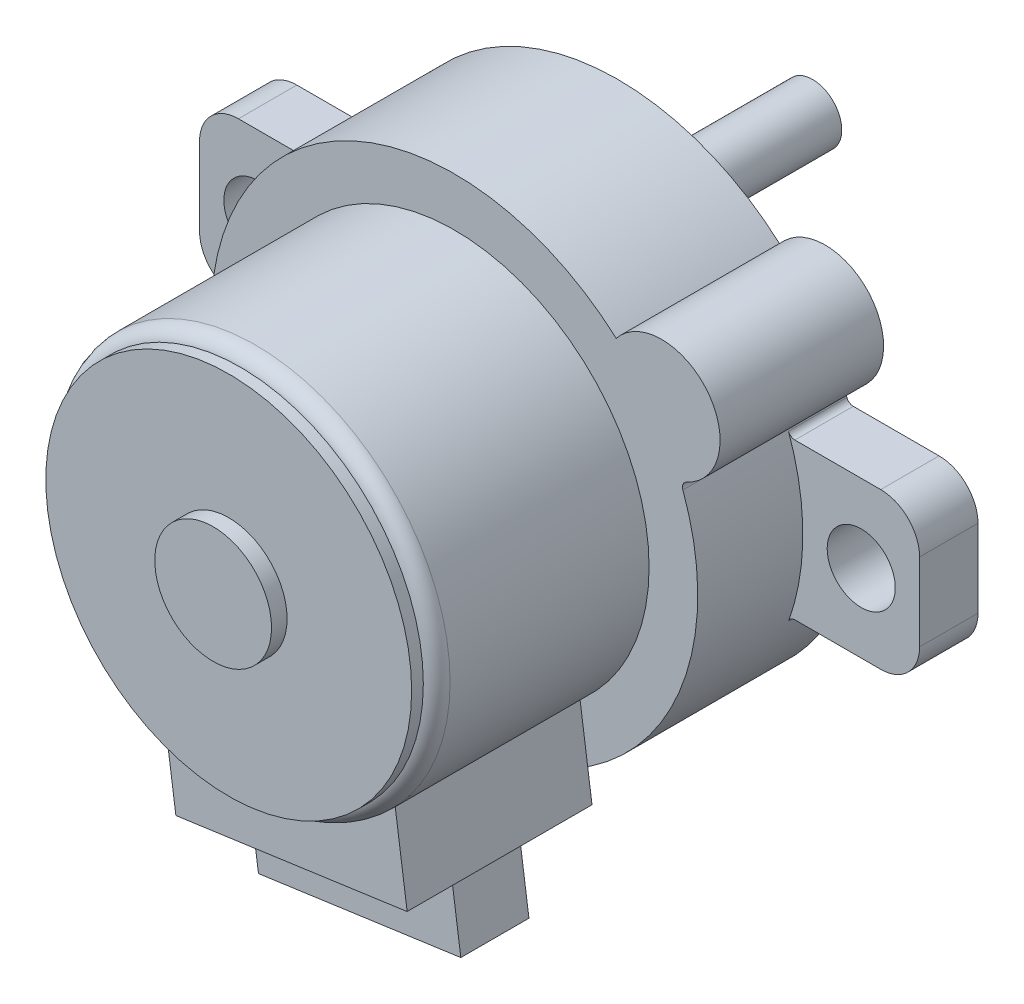
from build123d import *

# Parameters (mm, degrees)
SKETCH_1_R          = 10
EXTRUDE_1_DEPTH     = 11.6
SKETCH_2_R          = 12.5
EXTRUDE_2_DEPTH     = 8.4
EXTRUDE_START       = -3
SKETCH_3_R          = 1.75
SKETCH_3_R_2        = 1.749999999999227
EXTRUDE_3_DEPTH     = 3
EXTRUDE_START_2     = 5.4
EXTRUDE_4_DEPTH     = 5.4
SKETCH_5_R          = 3.000000000000001
EXTRUDE_5_DEPTH     = 2
SKETCH_6_R          = 1.5000000000000002
EXTRUDE_6_DEPTH     = 8
SKETCH_7_R          = 3
EXTRUDE_7_DEPTH     = 0.8
EXTRUDE_START_3     = -11
EXTRUDE_8_DEPTH     = 11
EXTRUDE_9_DEPTH     = 8
CUT_EXTRUDE_1_DEPTH = 4.5
FILLET_1_R          = 0.5
FILLET_4_R          = 0.35
CUT_EXTRUDE_START   = -1.5
CUT_EXTRUDE_2_DEPTH = 1.5
CUT_EXTRUDE_START_2 = -0.6
SKETCH_12_R         = 10
SKETCH_12_R_2       = 9.4
CUT_EXTRUDE_3_DEPTH = 0.6
FILLET_5_R          = 0.8


with BuildPart() as part:
    # ｽｹｯﾁ1 → ﾎﾞｽ - 押し出し1 (new body)
    with BuildSketch(Plane.XY):
        Circle(SKETCH_1_R)
    extrude(amount=EXTRUDE_1_DEPTH)

    # ｽｹｯﾁ2 → ﾎﾞｽ - 押し出し2 (add)
    with BuildSketch(Plane.XY):
        Circle(SKETCH_2_R)
    extrude(amount=-EXTRUDE_2_DEPTH)

    # ｽｹｯﾁ3 → ﾎﾞｽ - 押し出し3 (add)
    # profile 1 of 4: a face of its own
    with BuildSketch(Plane(origin=(0, 0, -8.4), x_dir=(-1, 0, 0), z_dir=(0, 0, -1)).offset(EXTRUDE_START)):
        with BuildLine():
            Line((-18.500000000000004, 2.0000000000000004), (-18.500000000000004, -2.0000000000000004))
            ThreePointArc((-18.500000000000004, -2.0000000000000004), (-17.914213562373096, -3.4142135623730976), (-16.5, -4))
            Line((-16.5, -4), (-11.842719282327012, -4.000000000000001))
            ThreePointArc((-11.842719282327012, -4.000000000000001), (-12.500000000000002, 1.53e-15), (-11.842719282327012, 4.000000000000001))
            Line((-11.842719282327012, 4.000000000000001), (-16.5, 4))
            ThreePointArc((-16.5, 4), (-17.914213562373096, 3.4142135623730976), (-18.500000000000004, 2.0000000000000004))
        make_face()
        with Locations((-15.5, 0)):
            Circle(SKETCH_3_R, mode=Mode.SUBTRACT)
    # profile 2 of 4: a face of its own
    with BuildSketch(Plane(origin=(0, 0, -8.4), x_dir=(-1, 0, 0), z_dir=(0, 0, -1)).offset(EXTRUDE_START)):
        with BuildLine():
            Line((16.50000000000071, 3.999999999997067), (11.842719282327723, 3.999999999997894))
            ThreePointArc((11.842719282327723, 3.999999999997894), (12.500000000000002, -2.22183e-12), (11.842719282326302, -4.000000000002104))
            Line((11.842719282326302, -4.000000000002104), (16.49999999999929, -4.000000000002934))
            ThreePointArc((16.49999999999929, -4.000000000002934), (17.914213562372492, -3.414213562376281), (18.49999999999965, -2.000000000003289))
            Line((18.49999999999965, -2.000000000003289), (18.500000000000355, 1.999999999996712))
            ThreePointArc((18.500000000000355, 1.999999999996712), (17.9142135623737, 3.414213562369911), (16.50000000000071, 3.999999999997067))
        make_face()
        with Locations((15.5, -2.75525e-12)):
            Circle(SKETCH_3_R_2, mode=Mode.SUBTRACT)
    # profile 3 of 4: a face of its own
    with BuildSketch(Plane(origin=(0, 0, -8.4), x_dir=(-1, 0, 0), z_dir=(0, 0, -1)).offset(EXTRUDE_START)):
        with BuildLine():
            ThreePointArc((-8.311246450809406, 9.336657990625344), (-10.239400553612443, 7.1697054543880165), (-11.616202318913265, 4.616691855222107))
            ThreePointArc((-11.616202318913265, 4.616691855222107), (-13.106432708623924, 9.177222981616662), (-8.311246450809406, 9.336657990625344))
        make_face()
    # profile 4 of 4: a face of its own
    with BuildSketch(Plane(origin=(0, 0, -8.4), x_dir=(-1, 0, 0), z_dir=(0, 0, -1)).offset(EXTRUDE_START)):
        with BuildLine():
            ThreePointArc((8.311246450807749, -9.33665799062682), (10.239400553611166, -7.169705454389839), (11.616202318912443, -4.6166918552241745))
            ThreePointArc((11.616202318912443, -4.6166918552241745), (13.106432708622291, -9.177222981618991), (8.311246450807749, -9.33665799062682))
        make_face()
    extrude(amount=EXTRUDE_3_DEPTH)

    # ｽｹｯﾁ4 → ﾎﾞｽ - 押し出し4 (add)
    with BuildSketch(Plane.XY.offset(-5.400000000000001).offset(EXTRUDE_START_2)):
        with BuildLine():
            ThreePointArc((-11.616202318912443, -4.616691855224174), (-13.10643270862229, -9.17722298161899), (-8.311246450807749, -9.336657990626819))
            ThreePointArc((-8.311246450807749, -9.336657990626819), (-10.239400553611167, -7.169705454389835), (-11.616202318912443, -4.616691855224174))
        make_face()
        with BuildLine():
            ThreePointArc((11.616202318913265, 4.616691855222107), (13.106432708623922, 9.177222981616662), (8.311246450809406, 9.336657990625344))
            ThreePointArc((8.311246450809406, 9.336657990625344), (10.23940055361244, 7.169705454388018), (11.616202318913265, 4.616691855222107))
        make_face()
    extrude(amount=-EXTRUDE_4_DEPTH)

    # ｽｹｯﾁ5 → ﾎﾞｽ - 押し出し5 (add)
    with BuildSketch(Plane(origin=(0, 0, -8.4), x_dir=(-1, 0, 0), z_dir=(0, 0, -1))):
        with Locations(Location((1.1e-16, 6, 0), (0, 0, 180))):
            Circle(SKETCH_5_R)
    extrude(amount=EXTRUDE_5_DEPTH)

    # ｽｹｯﾁ6 → ﾎﾞｽ - 押し出し6 (add)
    with BuildSketch(Plane(origin=(0, 0, -10.400000000000002), x_dir=(-1, 0, 0), z_dir=(0, 0, -1))):
        with Locations((1.1e-16, 6)):
            Circle(SKETCH_6_R)
    extrude(amount=EXTRUDE_6_DEPTH)

    # ｽｹｯﾁ7 → ﾎﾞｽ - 押し出し7 (add)
    with BuildSketch(Plane.XY.offset(11.6)):
        Circle(SKETCH_7_R)
    extrude(amount=EXTRUDE_7_DEPTH)

    # ｽｹｯﾁ8 → ﾎﾞｽ - 押し出し8 (add)
    with BuildSketch(Plane.XY.offset(11.6).offset(EXTRUDE_START_3)):
        with BuildLine():
            Line((-4.215861960544603, -13.114362658155867), (7.667354864354238, -11.444285446635076))
            Line((7.667354864354238, -11.444285446635076), (7.054993220129948, -7.087105944172167))
            ThreePointArc((7.054993220129948, -7.087105944172167), (1.3917310096006568, -9.902680687415703), (-4.828223604768894, -8.757183155692958))
            Line((-4.828223604768894, -8.757183155692958), (-4.215861960544603, -13.114362658155867))
        make_face()
    extrude(amount=EXTRUDE_8_DEPTH)

    # ｽｹｯﾁ9 → ﾎﾞｽ - 押し出し9 (add)
    with BuildSketch(Plane.XY.offset(11.6)):
        Polygon((-3.4731609089884254, -13.009982832435817), (-2.9721377455321845, -16.57494787990548), (7.4256769762543025, -15.113630319824779), (6.924653812798063, -11.548665272355127), align=None)
    extrude(amount=-EXTRUDE_9_DEPTH)

    # ｽｹｯﾁ10 → ｶｯﾄ - 押し出し1 (cut)
    with BuildSketch(Plane.XY.offset(11.6)):
        Polygon((6.924653812798063, -11.548665272355127), (-3.4731609089884254, -13.009982832435817), (-2.9721377455321845, -16.57494787990548), (7.4256769762543025, -15.113630319824779), align=None)
    extrude(amount=-CUT_EXTRUDE_1_DEPTH, mode=Mode.SUBTRACT)

    # ﾌｨﾚｯﾄ1
    fillet_1_edges = [part.edges().sort_by_distance(p)[0] for p in [
        (1.7257464519048185, -12.279324052395472, 3.5999999999999996),
        (-3.4731609089884254, -13.009982832435817, 5.35),
        (6.924653812798063, -11.548665272355127, 5.35),
        (1.7257464519048185, -12.279324052395472, 7.1),
    ]]
    fillet(fillet_1_edges, radius=FILLET_1_R)

    # ﾌｨﾚｯﾄ4
    fillet_4_edges = [part.edges().sort_by_distance(p)[0] for p in [
        (11.616202318913265, 4.616691855222108, -4.200000000000001),
        (11.84271928232701, 4.000000000000002, -6.9),
        (11.84271928232701, -4.000000000000001, -6.9),
        (-11.616202318912443, -4.6166918552241745, -4.2),
        (-11.8427192823263, -4.000000000002105, -6.9),
        (-11.842719282327721, 3.999999999997894, -6.9),
    ]]
    fillet(fillet_4_edges, radius=FILLET_4_R)

    # ｽｹｯﾁ11 → ｶｯﾄ - 押し出し2 (cut)
    with BuildSketch(Plane.XY.offset(11.6).offset(CUT_EXTRUDE_START)):
        with BuildLine():
            Line((-4.828223604768897, -8.757183155692957), (-4.215861960544603, -13.114362658155867))
            Line((-4.215861960544603, -13.114362658155867), (7.667354864354238, -11.444285446635076))
            Line((7.667354864354238, -11.444285446635076), (7.054993220129944, -7.087105944172171))
            ThreePointArc((7.054993220129944, -7.087105944172171), (1.3917310096006545, -9.902680687415703), (-4.828223604768897, -8.757183155692957))
        make_face()
    extrude(amount=CUT_EXTRUDE_2_DEPTH, mode=Mode.SUBTRACT)

    # ｽｹｯﾁ12 → ｶｯﾄ - 押し出し3 (cut)
    with BuildSketch(Plane.XY.offset(11.6).offset(CUT_EXTRUDE_START_2)):
        Circle(SKETCH_12_R)
        Circle(SKETCH_12_R_2, mode=Mode.SUBTRACT)
    extrude(amount=CUT_EXTRUDE_3_DEPTH, mode=Mode.SUBTRACT)

    # ﾌｨﾚｯﾄ5
    # the kernel refuses this fillet: 0.8 mm, written as the material it takes off along each edge
    with BuildSketch(Plane(origin=(0, 0, 11), x_dir=(0.7054993220130121, -0.7087105944171995, 0), z_dir=(-0.7087105944171995, -0.7054993220130121, 0))) as fillet_5_piece_1:
        with BuildLine():
            CenterArc((9.200000000000001, -0.7745966692414843), FILLET_5_R, 0, 75.52248781407015)
            Line((9.4, 0), (9.404000000000002, 0.01549193338482979))
            ThreePointArc((9.404000000000002, 0.01549193338482979), (9.700000000000001, 0.01600000000000001), (10, 0.01600000000000001))
            Line((10, 0.01600000000000001), (10.016, 0))
            Line((10.016, 0), (10.016, -0.7745966692414843))
            Line((10.016, -0.7745966692414843), (10, -0.7745966692414843))
        make_face()
    revolve(axis=Axis((0, 0, 11), (0, 0, 1)), revolution_arc=45.130102354154545, mode=Mode.SUBTRACT)
    with BuildSketch(Plane(origin=(0, 0, 11), x_dir=(-0.48282236047689747, -0.8757183155692913, 0), z_dir=(-0.8757183155692913, 0.48282236047689747, 0))) as fillet_5_piece_2:
        with BuildLine():
            CenterArc((9.200000000000001, -0.7745966692414824), FILLET_5_R, 0, 75.52248781407025)
            Line((10.000000000000002, -0.7745966692414824), (10.016000000000002, -0.7745966692414824))
            Line((10.016000000000002, -0.7745966692414824), (10.016, 0))
            Line((10.016, 0), (10, 0.01600000000000001))
            ThreePointArc((10, 0.01600000000000001), (9.699999999999998, 0.01600000000000001), (9.404, 0.01549193338483157))
            Line((9.404, 0.01549193338483157), (9.399999999999999, 1.78e-15))
        make_face()
    revolve(axis=Axis((0, 0, 11), (0, 0, 1)), revolution_arc=73.73979529168996, mode=Mode.SUBTRACT)
    with BuildSketch(Plane(origin=(0, 0, 11), x_dir=(1, 0, 0), z_dir=(0, -1, 0))) as fillet_5_piece_3:
        with BuildLine():
            CenterArc((9.2, -0.7745966692414825), FILLET_5_R, 0, 75.52248781406999)
            Line((9.4, 0), (9.404, 0.01549193338482979))
            ThreePointArc((9.404, 0.01549193338482979), (9.7, 0.01600000000000001), (10, 0.01600000000000001))
            Line((10, 0.01600000000000001), (10.016, 0))
            Line((10.016, 0), (10.016, -0.7745966692414825))
            Line((10.016, -0.7745966692414825), (10, -0.7745966692414825))
        make_face()
    revolve(axis=Axis((0, 0, 11), (0, 0, 1)), revolution_arc=241.1301023541555, mode=Mode.SUBTRACT)


solid = part.part
